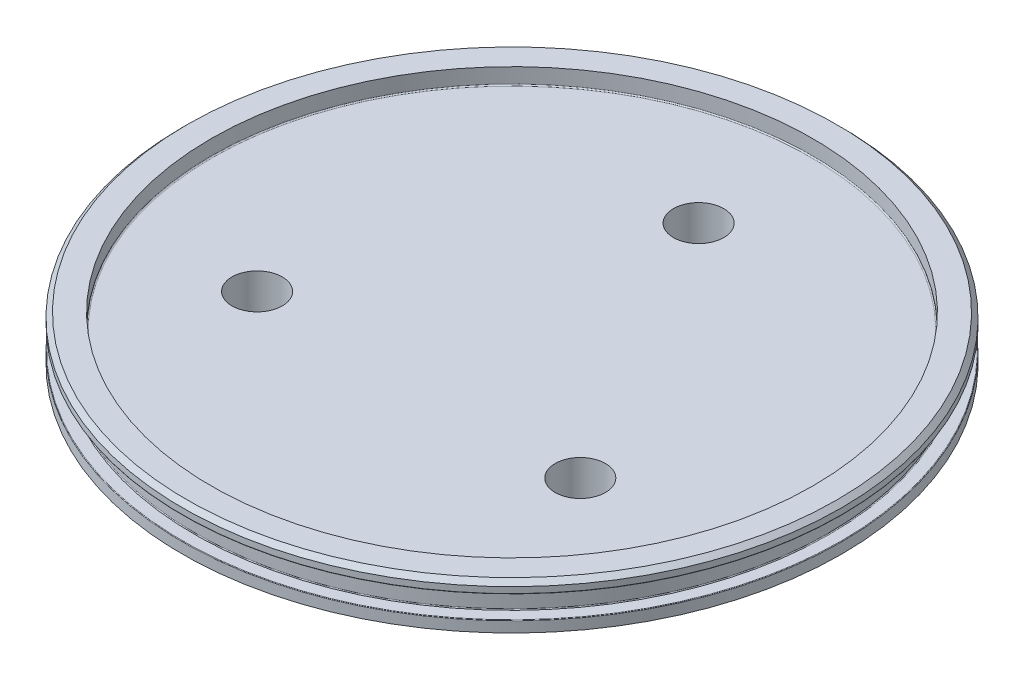
from build123d import *

# Parameters (mm, degrees)
SKETCH6_R                        = 66.04
BOSS_EXTRUDE1_DEPTH              = 2.54
PIPE_TAP_DRILL_FOR_1_4_TAP_GN2_D = 11.1252
CNC_ID_FILLET_R                  = 0.1778
CNC_OD_FILLET_R                  = 0.127
CNC_CHAMFERS_SIZE                = 1.016
CNC_BORE_FILLET_R                = 0.254


with BuildPart() as part:
    # Sketch1 → Revolve1 (revolve)
    with BuildSketch(Plane.XY):
        Polygon((0, 0), (72.898, 0), (72.898, 2.4638), (70.0532, 2.4638), (70.0532, 7.4422), (72.898, 7.4422), (72.898, 9.906), (66.548, 9.906), (66.548, 6.35), (0, 6.35), align=None)
    revolve(axis=Axis((0, 48.192213231, 0), (0, -1, 0)))

    # Sketch6 → Boss-Extrude1 (add)
    with BuildSketch(Plane.XZ):
        Circle(SKETCH6_R)
    extrude(amount=BOSS_EXTRUDE1_DEPTH)

    # Pipe Tap Drill for 1/4 Tap - GN2 (through all)
    with Locations(Plane(origin=(0, 6.35, 0), x_dir=(1, 0, 0), z_dir=(0, 1, 0))):
        with Locations((35.745198541, -20.6375), (-35.745198541, -20.6375), (0, 41.275)):
            Hole(PIPE_TAP_DRILL_FOR_1_4_TAP_GN2_D / 2)

    # CNC ID Fillet
    cnc_id_fillet_edges = [part.edges().sort_by_distance(p)[0] for p in [
        (-70.0532, 7.4422, 0),
        (-70.0532, 2.4638, 0),
        (-66.04, 0, 0),
    ]]
    fillet(cnc_id_fillet_edges, radius=CNC_ID_FILLET_R)

    # CNC OD Fillet
    cnc_od_fillet_edges = [part.edges().sort_by_distance(p)[0] for p in [
        (-72.898, 7.4422, 0),
        (-72.898, 2.4638, 0),
        (-66.04, -2.54, 0),
    ]]
    fillet(cnc_od_fillet_edges, radius=CNC_OD_FILLET_R)

    # CNC Chamfers
    cnc_chamfers_edges = [part.edges().sort_by_distance(p)[0] for p in [
        (-72.898, 9.906, 0),
    ]]
    chamfer(cnc_chamfers_edges, length=CNC_CHAMFERS_SIZE)

    # CNC Bore Fillet
    cnc_bore_fillet_edges = [part.edges().sort_by_distance(p)[0] for p in [
        (-66.548, 6.35, 0),
    ]]
    fillet(cnc_bore_fillet_edges, radius=CNC_BORE_FILLET_R)


solid = part.part
